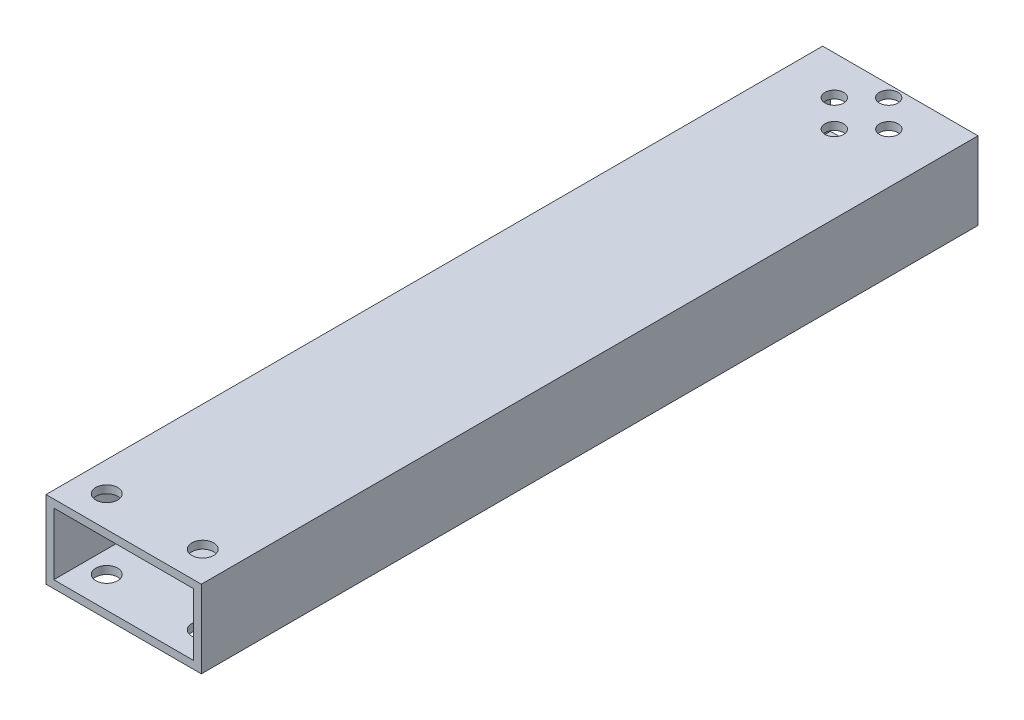
from build123d import *

# Parameters (mm, degrees)
SKETCH1_W               = 25.4
SKETCH1_H               = 12.7
BOSS_EXTRUDE1_DEPTH     = 127
SKETCH4_W               = 22.86
SKETCH4_H               = 10.16
CUT_EXTRUDE1_DEPTH      = 128.791284914
CUT_EXTRUDE2_DEPTH      = 129.263712717
CUT_EXTRUDE2_DEPTH_BACK = 129.263712717
SKETCH5_R               = 1.7907
CUT_EXTRUDE3_DEPTH      = 129.263712717
CUT_EXTRUDE3_DEPTH_BACK = 129.263712717
SKETCH6_R               = 1.524


with BuildPart() as part:
    # Sketch1 → Boss-Extrude1 (new body)
    with BuildSketch(Plane.XY):
        Rectangle(SKETCH1_W, SKETCH1_H)
    extrude(amount=BOSS_EXTRUDE1_DEPTH)

    # Sketch4 → Cut-Extrude1 (cut, through all)
    with BuildSketch(Plane(origin=(0, 0, 0), x_dir=(-1, 0, 0), z_dir=(0, 0, -1))):
        Rectangle(SKETCH4_W, SKETCH4_H)
    extrude(amount=-CUT_EXTRUDE1_DEPTH, mode=Mode.SUBTRACT)

    # Sketch5 → Cut-Extrude2 (cut, two sides: drawn at the far end of the back side and taken through both)
    with BuildSketch(Plane(origin=(0, 6.35, 0), x_dir=(1, 0, 0), z_dir=(0, 1, 0)).offset(-CUT_EXTRUDE2_DEPTH_BACK)):
        with Locations((-7.8486, -121.92)):
            Circle(SKETCH5_R)
        with Locations((7.8486, -121.92)):
            Circle(SKETCH5_R)
    extrude(amount=CUT_EXTRUDE2_DEPTH + CUT_EXTRUDE2_DEPTH_BACK, mode=Mode.SUBTRACT)

    # Sketch6 → Cut-Extrude3 (cut, two sides: drawn at the far end of the back side and taken through both)
    with BuildSketch(Plane(origin=(0, -6.35, 0), x_dir=(-1, 0, 0), z_dir=(0, -1, 0)).offset(-CUT_EXTRUDE3_DEPTH_BACK)):
        with Locations((4.445, -6.35)):
            Circle(SKETCH6_R)
        with Locations((-4.4704, -6.35)):
            Circle(SKETCH6_R)
        with Locations((0, -1.905)):
            Circle(SKETCH6_R)
        with Locations((0, -10.795)):
            Circle(SKETCH6_R)
    extrude(amount=CUT_EXTRUDE3_DEPTH + CUT_EXTRUDE3_DEPTH_BACK, mode=Mode.SUBTRACT)


solid = part.part
